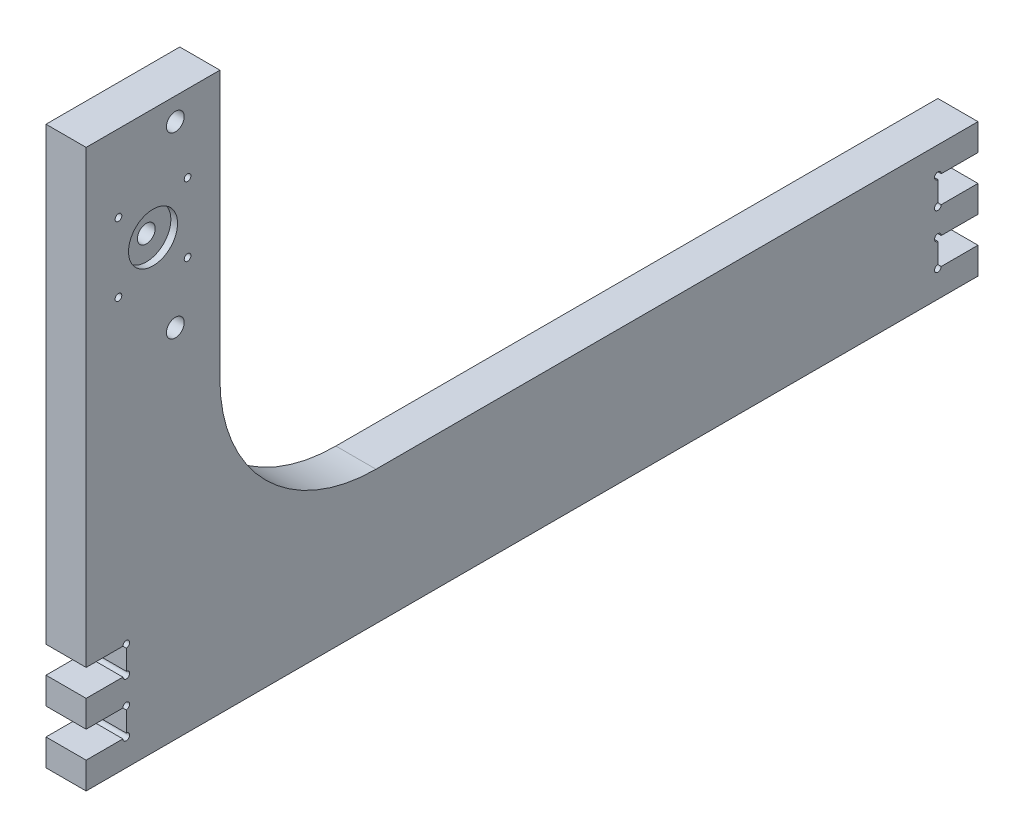
from build123d import *

# Parameters (mm, degrees)
SKETCH1_R           = 4
SKETCH1_R_2         = 1.5
BOSS_EXTRUDE1_DEPTH = 18
SKETCH3_R           = 11
CUT_EXTRUDE1_DEPTH  = 3


with BuildPart() as part:
    # Sketch1 → Boss-Extrude1 (new body)
    with BuildSketch(Plane(origin=(0, 0, 0), x_dir=(0, 0, -1), z_dir=(1, 0, 0))):
        with BuildLine():
            Line((-30, -238), (-30, -250))
            Line((-30, -250), (370, -250))
            Line((370, -250), (370, -238))
            Line((370, -238), (353.5, -238))
            ThreePointArc((353.5, -238), (350.939339828, -239.060660172), (352, -236.5))
            Line((352, -236.5), (352, -227.5))
            ThreePointArc((352, -227.5), (350.939339828, -224.939339828), (353.5, -226))
            Line((353.5, -226), (370, -226))
            Line((370, -226), (370, -214))
            Line((370, -214), (353.5, -214))
            ThreePointArc((353.5, -214), (350.939339828, -215.060660172), (352, -212.5))
            Line((352, -212.5), (352, -203.5))
            ThreePointArc((352, -203.5), (350.939339828, -200.939339828), (353.5, -202))
            Line((353.5, -202), (370, -202))
            Line((370, -202), (370, -190))
            Line((370, -190), (100, -190))
            ThreePointArc((100, -190), (50.502525317, -169.497474683), (30, -120))
            Line((30, -120), (30, 0))
            Line((30, 0), (-30, 0))
            Line((-30, 0), (-30, -202))
            Line((-30, -202), (-13.5, -202))
            ThreePointArc((-13.5, -202), (-10.939336862, -200.939351183), (-12, -203.500008389))
            Line((-12, -203.500008389), (-12, -212.500008389))
            ThreePointArc((-12, -212.500008389), (-10.939342794, -215.060671527), (-13.5, -214))
            Line((-13.5, -214), (-30, -214))
            Line((-30, -214), (-30, -226.000008389))
            Line((-30, -226.000008389), (-13.5, -226.000008389))
            ThreePointArc((-13.5, -226.000008389), (-10.939339828, -224.939348217), (-12, -227.500008389))
            Line((-12, -227.500008389), (-12, -236.500008389))
            ThreePointArc((-12, -236.500008389), (-10.939342794, -239.060671527), (-13.5, -238))
            Line((-13.5, -238), (-30, -238))
        make_face()
        with Locations((10, -90)):
            Circle(SKETCH1_R, mode=Mode.SUBTRACT)
        with Locations((-15.5, -65.5)):
            Circle(SKETCH1_R_2, mode=Mode.SUBTRACT)
        with Locations((15.5, -65.5)):
            Circle(SKETCH1_R_2, mode=Mode.SUBTRACT)
        with Locations((0, -50)):
            Circle(SKETCH1_R, mode=Mode.SUBTRACT)
        with Locations((-15.5, -34.5)):
            Circle(SKETCH1_R_2, mode=Mode.SUBTRACT)
        with Locations((15.5, -34.5)):
            Circle(SKETCH1_R_2, mode=Mode.SUBTRACT)
        with Locations((10, -10)):
            Circle(SKETCH1_R, mode=Mode.SUBTRACT)
    extrude(amount=BOSS_EXTRUDE1_DEPTH)

    # Sketch3 → Cut-Extrude1 (cut)
    with BuildSketch(Plane(origin=(18, 0, 0), x_dir=(0, 0, -1), z_dir=(1, 0, 0))):
        with Locations((0, -50)):
            Circle(SKETCH3_R)
    extrude(amount=-CUT_EXTRUDE1_DEPTH, mode=Mode.SUBTRACT)


solid = part.part
